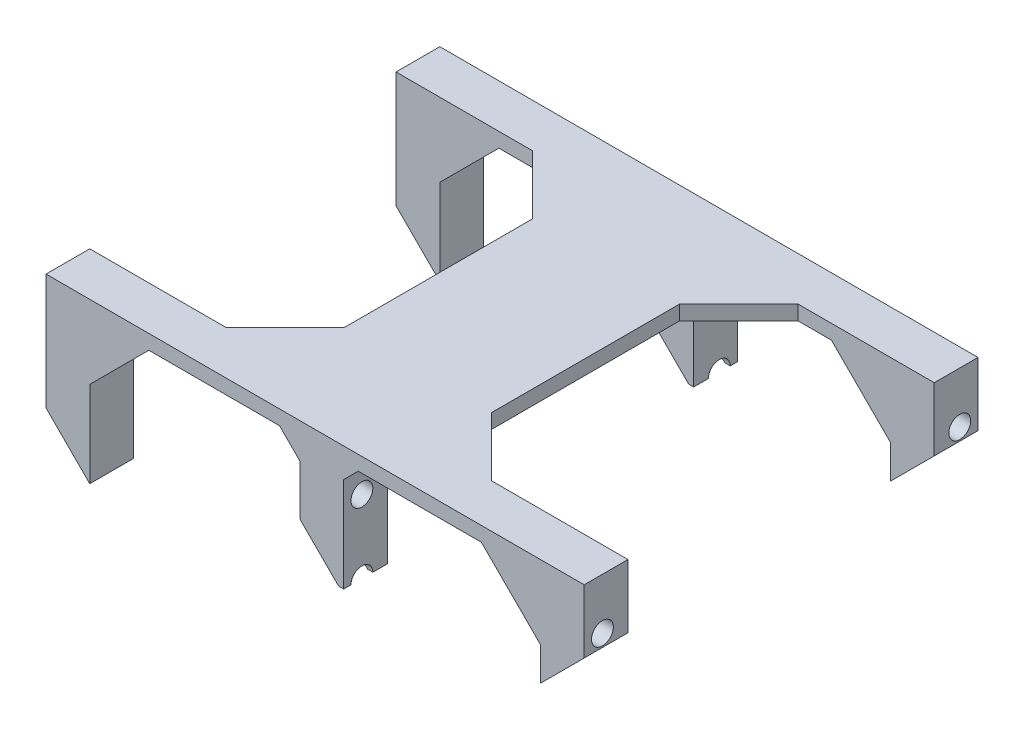
from build123d import *

# Parameters (mm, degrees)
SKETCH1_W               = 47
SKETCH1_H               = 54
BOSS_EXTRUDE1_DEPTH     = 2
SKETCH2_W               = 6
SKETCH2_H               = 6
BOSS_EXTRUDE2_DEPTH     = 15
CHAMFER1_SIZE           = 5.3
CHAMFER2_SIZE           = 8.3
SKETCH3_R               = 1.5
CUT_EXTRUDE1_DEPTH      = 50.733694815
CHAMFER3_SIZE           = 2.8
CHAMFER4_SIZE           = 2
SKETCH4_W               = 6
SKETCH4_H               = 2
BOSS_EXTRUDE3_DEPTH     = 26.8
SKETCH6_W               = 6
SKETCH6_H               = 6
BOSS_EXTRUDE4_DEPTH     = 22
CHAMFER5_SIZE           = 8.1
CUT_EXTRUDE2_DEPTH      = 61.457423035
CHAMFER6_SIZE           = 8.1
CUT_EXTRUDE3_DEPTH      = 53.832588428
CUT_EXTRUDE3_DEPTH_BACK = 53.832588428
SKETCH8_R               = 1.5


with BuildPart() as part:
    # Sketch1 → Boss-Extrude1 (new body)
    with BuildSketch(Plane(origin=(0, 0, 0), x_dir=(1, 0, 0), z_dir=(0, 1, 0))):
        Rectangle(SKETCH1_W, SKETCH1_H)
    extrude(amount=BOSS_EXTRUDE1_DEPTH)

    # Sketch2 → Boss-Extrude2 (add)
    with BuildSketch(Plane.XZ):
        with Locations((-12.48, 24)):
            Rectangle(SKETCH2_W, SKETCH2_H)
        with Locations((20.5, 24)):
            Rectangle(SKETCH2_W, SKETCH2_H)
        with Locations((20.5, -24)):
            Rectangle(SKETCH2_W, SKETCH2_H)
        with Locations((-12.48, -24)):
            Rectangle(SKETCH2_W, SKETCH2_H)
    extrude(amount=BOSS_EXTRUDE2_DEPTH)

    # Chamfer1
    chamfer1_edges = [part.edges().sort_by_distance(p)[0] for p in [
        (-15.48, -15, 24),
        (-15.48, -15, -24),
    ]]
    chamfer(chamfer1_edges, length=CHAMFER1_SIZE)

    # Chamfer2
    # the kernel refuses this chamfer: 8.3 mm, written as the material it takes off along each edge
    with BuildSketch(Plane(origin=(23.5, -15, 0.3449688), x_dir=(0.027495876610586414, 0.9996219169112966, 0), z_dir=(0, 0, -1)), Plane(origin=(23.5, -15, -0.3449688), x_dir=(-0.9996219169112969, -0.027495876610586417, 0), z_dir=(0, 0, 1))) as chamfer2_piece_1:
        Polygon((CHAMFER2_SIZE * 0.999621916911, -CHAMFER2_SIZE * 0.0274958766106), (-CHAMFER2_SIZE * 0.0274958766106, -CHAMFER2_SIZE * 0.999621916911), (0, 0), align=None)
    extrude(amount=48.6899376, mode=Mode.SUBTRACT)

    # Sketch3 → Cut-Extrude1 (cut, through all)
    with BuildSketch(Plane.ZY.offset(15.48)):
        with Locations((24.5, -5)):
            Circle(SKETCH3_R)
        with Locations((-24.5, -5)):
            Circle(SKETCH3_R)
        with Locations((24.5, -15)):
            Circle(SKETCH3_R)
        with Locations((-24.5, -15)):
            Circle(SKETCH3_R)
    extrude(amount=-CUT_EXTRUDE1_DEPTH, mode=Mode.SUBTRACT)

    # Chamfer3
    chamfer3_edges = [part.edges().sort_by_distance(p)[0] for p in [
        (-15.48, 0, 24),
        (-15.48, 0, -24),
    ]]
    chamfer(chamfer3_edges, length=CHAMFER3_SIZE)

    # Chamfer4
    chamfer4_edges = [part.edges().sort_by_distance(p)[0] for p in [
        (-9.48, 0, 24),
        (-9.48, 0, -24),
    ]]
    chamfer(chamfer4_edges, length=CHAMFER4_SIZE)

    # Sketch4 → Boss-Extrude3 (add)
    with BuildSketch(Plane.ZY.offset(23.5)):
        with Locations((24, 1)):
            Rectangle(SKETCH4_W, SKETCH4_H)
        with Locations((-24, 1)):
            Rectangle(SKETCH4_W, SKETCH4_H)
    extrude(amount=BOSS_EXTRUDE3_DEPTH)

    # Sketch6 → Boss-Extrude4 (add)
    with BuildSketch(Plane.XZ):
        with Locations((-47.3, 24)):
            Rectangle(SKETCH6_W, SKETCH6_H)
        with Locations((-47.3, -24)):
            Rectangle(SKETCH6_W, SKETCH6_H)
    extrude(amount=BOSS_EXTRUDE4_DEPTH)

    # Chamfer5
    # the kernel refuses this chamfer: 8.1 mm, written as the material it adds along each edge
    with BuildSketch(Plane(origin=(-23.5, 2, 21), x_dir=(0.027495876610586174, 0, -0.9996219169112968), z_dir=(0, -1, 0)), Plane(origin=(-23.5, 2, -21), x_dir=(-0.9996219169112968, 0, -0.02749587661058618), z_dir=(0, -1, 0))) as chamfer5_piece_1:
        Polygon((CHAMFER5_SIZE * 0.999621916911, -CHAMFER5_SIZE * 0.0274958766106), (-CHAMFER5_SIZE * 0.0274958766106, -CHAMFER5_SIZE * 0.999621916911), (0, 0), align=None)
    extrude(amount=2)
    with BuildSketch(Plane(origin=(-44.3, 0, 27), x_dir=(-0.027495876610586608, -0.9996219169112968, 0), z_dir=(0, 0, -1))) as chamfer5_piece_2:
        Polygon((CHAMFER5_SIZE * 0.999621916911, -CHAMFER5_SIZE * 0.0274958766106), (-CHAMFER5_SIZE * 0.0274958766106, -CHAMFER5_SIZE * 0.999621916911), (0, 0), align=None)
    extrude(amount=6)
    with BuildSketch(Plane(origin=(-44.3, 0, -27), x_dir=(-0.027495876610586608, -0.9996219169112968, 0), z_dir=(0, 0, 1))) as chamfer5_piece_3:
        Polygon((CHAMFER5_SIZE * 0.999621916911, CHAMFER5_SIZE * 0.0274958766106), (-CHAMFER5_SIZE * 0.0274958766106, CHAMFER5_SIZE * 0.999621916911), (0, 0), align=None)
    extrude(amount=6)
    # the kernel refuses this chamfer: 8.1 mm, written as the material it takes off along each edge
    with BuildSketch(Plane(origin=(-50.3, -22, 0.169367797), x_dir=(0.9996219169112968, -0.027495876610586167, 0), z_dir=(0, 0, 1)), Plane(origin=(-50.3, -22, -0.169367797), x_dir=(-0.027495876610586608, 0.9996219169112968, 0), z_dir=(0, 0, -1))) as chamfer5_2_piece_1:
        Polygon((CHAMFER5_SIZE * 0.999621916911, CHAMFER5_SIZE * 0.0274958766106), (-CHAMFER5_SIZE * 0.0274958766106, CHAMFER5_SIZE * 0.999621916911), (0, 0), align=None)
    extrude(amount=47.661264405, mode=Mode.SUBTRACT)

    # Sketch7 → Cut-Extrude2 (cut, through all)
    with BuildSketch(Plane.XZ):
        Polygon((9.4, 21), (17.5, 21), (23.5, 21), (23.5, -21), (17.5, -21), (9.4, -21), (4.8, -21), (-3.3, -12.9), (-3.3, 12.9), (4.8, 21), align=None)
    extrude(amount=-CUT_EXTRUDE2_DEPTH, mode=Mode.SUBTRACT)

    # Chamfer6
    # the kernel refuses this chamfer: 8.1 mm, written as the material it adds along each edge
    with BuildSketch(Plane(origin=(17.5, 0, 27), x_dir=(0.02749587661058618, -0.9996219169112968, 0), z_dir=(0, 0, -1))) as chamfer6_piece_1_section:
        Polygon((CHAMFER6_SIZE * 0.999621916911, CHAMFER6_SIZE * 0.0274958766106), (-CHAMFER6_SIZE * 0.0274958766106, CHAMFER6_SIZE * 0.999621916911), (0, 0), align=None)
    chamfer6_piece_1 = extrude(amount=6, mode=Mode.PRIVATE)
    chamfer6_piece_1 = chamfer6_piece_1 - Plane(origin=(14.692276243, -5, 24.5), x_dir=(0, 0, 1), z_dir=(-1, 0, 0)) * Cylinder(1.5, 45, mode=Mode.PRIVATE)
    add(chamfer6_piece_1)
    with BuildSketch(Plane(origin=(17.5, 0, -27), x_dir=(0.02749587661058618, -0.9996219169112968, 0), z_dir=(0, 0, 1))) as chamfer6_piece_2_section:
        Polygon((CHAMFER6_SIZE * 0.999621916911, -CHAMFER6_SIZE * 0.0274958766106), (-CHAMFER6_SIZE * 0.0274958766106, -CHAMFER6_SIZE * 0.999621916911), (0, 0), align=None)
    chamfer6_piece_2 = extrude(amount=6, mode=Mode.PRIVATE)
    chamfer6_piece_2 = chamfer6_piece_2 - Plane(origin=(14.692276222, -5, -24.5), x_dir=(0, 0, 1), z_dir=(-1, 0, 0)) * Cylinder(1.5, 45, mode=Mode.PRIVATE)
    add(chamfer6_piece_2)

    # Sketch8 → Cut-Extrude3 (cut, two sides: drawn at the far end of the back side and taken through both)
    with BuildSketch(Plane(origin=(-9.48, 0, 0), x_dir=(0, 0, -1), z_dir=(1, 0, 0)).offset(-CUT_EXTRUDE3_DEPTH_BACK)):
        with Locations(Location((-24.5, -5, 0), (0, 0, 180))):
            Circle(SKETCH8_R)
        with Locations(Location((24.5, -5, 0), (0, 0, 180))):
            Circle(SKETCH8_R)
    extrude(amount=CUT_EXTRUDE3_DEPTH + CUT_EXTRUDE3_DEPTH_BACK, mode=Mode.SUBTRACT)


solid = part.part
